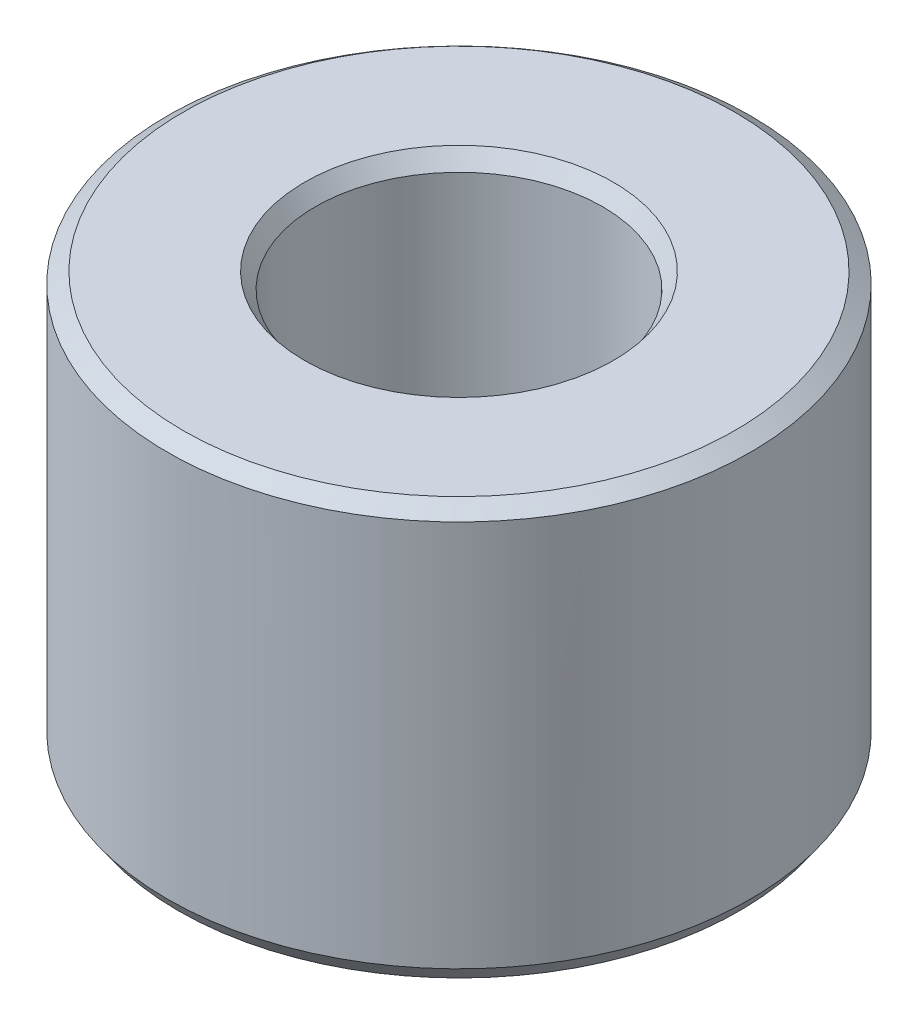
from build123d import *
from OCP.BRepFilletAPI import BRepFilletAPI_MakeChamfer

# Parameters (mm, degrees)
SKETCH1_R           = 37.5
BOSS_EXTRUDE1_DEPTH = 53.206039833
SKETCH2_R           = 18.463602063
CUT_EXTRUDE1_DEPTH  = 76.122451203
CHAMFER1_SIZE       = 1.407435228
CHAMFER1_SIZE2      = 2.014255724


with BuildPart() as part:
    # Sketch1 → Boss-Extrude1 (new body)
    with BuildSketch(Plane(origin=(0, 0, 0), x_dir=(1, 0, 0), z_dir=(0, 1, 0))):
        Circle(SKETCH1_R)
    extrude(amount=BOSS_EXTRUDE1_DEPTH)

    # Sketch2 → Cut-Extrude1 (cut, through all)
    with BuildSketch(Plane(origin=(0, 0, 0), x_dir=(1, 0, 0), z_dir=(0, 1, 0))):
        Circle(SKETCH2_R)
    extrude(amount=CUT_EXTRUDE1_DEPTH, mode=Mode.SUBTRACT)

    # Chamfer1: one chamfer whose edges measure the first distance from different faces: ONE call of the kernel's chamfer builder (chamfer() names one face for all edges)
    chamfer1_edges_1 = [part.edges().sort_by_distance(p)[0] for p in [
        (-18.463602063, 53.206039833, 0),
    ]]
    chamfer1_side_1 = [part.faces().sort_by_distance(p)[0] for p in [
        (-36.439339828, 53.206039833, 0),
    ]]
    chamfer1_edges_2 = [part.edges().sort_by_distance(p)[0] for p in [
        (-18.463602063, 0, 0),
    ]]
    chamfer1_side_2 = [part.faces().sort_by_distance(p)[0] for p in [
        (-18.463602063, 26.603019916, 0),
    ]]
    chamfer1_edges_3 = [part.edges().sort_by_distance(p)[0] for p in [
        (-37.5, 0, 0),
    ]]
    chamfer1_side_3 = [part.faces().sort_by_distance(p)[0] for p in [
        (-36.439339828, 0, 0),
    ]]
    chamfer1_edges_4 = [part.edges().sort_by_distance(p)[0] for p in [
        (-37.5, 53.206039833, 0),
    ]]
    chamfer1_side_4 = [part.faces().sort_by_distance(p)[0] for p in [
        (-37.5, 26.603019916, 0),
    ]]
    chamfer1 = BRepFilletAPI_MakeChamfer(part.part.solid().wrapped)
    for e in chamfer1_edges_1:
        chamfer1.Add(CHAMFER1_SIZE, CHAMFER1_SIZE2, e.wrapped, chamfer1_side_1[0].wrapped)  # the first distance lies on this face
    for e in chamfer1_edges_2:
        chamfer1.Add(CHAMFER1_SIZE, CHAMFER1_SIZE2, e.wrapped, chamfer1_side_2[0].wrapped)  # the first distance lies on this face
    for e in chamfer1_edges_3:
        chamfer1.Add(CHAMFER1_SIZE, CHAMFER1_SIZE2, e.wrapped, chamfer1_side_3[0].wrapped)  # the first distance lies on this face
    for e in chamfer1_edges_4:
        chamfer1.Add(CHAMFER1_SIZE, CHAMFER1_SIZE2, e.wrapped, chamfer1_side_4[0].wrapped)  # the first distance lies on this face
    add(Compound.cast(chamfer1.Shape()), mode=Mode.REPLACE)


solid = part.part
